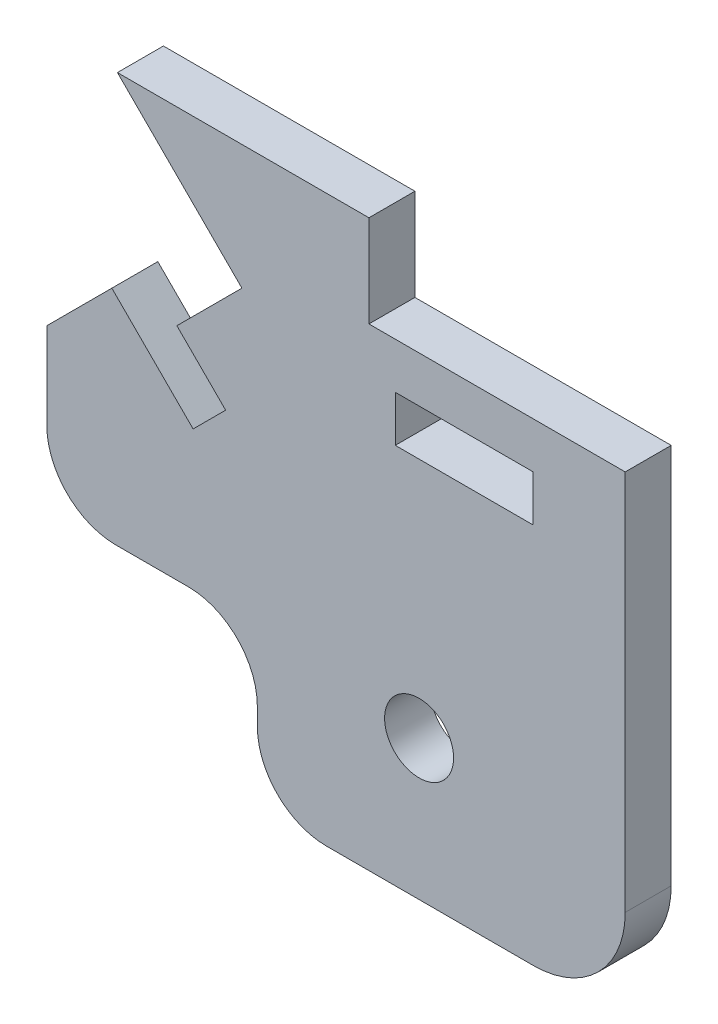
from build123d import *

# Parameters (mm, degrees)
MODEL_R             = 1.5
MODEL_W             = 6
MODEL_H             = 2
BOSS_EXTRUDE1_DEPTH = 2
BOSS_EXTRUDE2_DEPTH = 2


with BuildPart() as part:
    # Model → Boss-Extrude1 (new body)
    with BuildSketch(Plane.XY):
        with BuildLine():
            Line((6.363961031, 1.171572875), (2.828427125, 4.707106781))
            Line((2.828427125, 4.707106781), (0, 1.878679656))
            Line((0, 1.878679656), (0, -1.878679656))
            ThreePointArc((0, -1.878679656), (0.878679656, -4), (3, -4.878679656))
            Line((3, -4.878679656), (5.828427125, -4.878679656))
            Line((5.828427125, -4.878679656), (6.156854249, -4.878679656))
            ThreePointArc((6.156854249, -4.878679656), (8.278174593, -5.757359313), (9.156854249, -7.878679656))
            Line((9.156854249, -7.878679656), (9.156854249, -8.641362585))
            ThreePointArc((9.156854249, -8.641362585), (10.035533906, -10.762682929), (12.156854249, -11.641362585))
            Line((12.156854249, -11.641362585), (21.156854249, -11.641362585))
            ThreePointArc((21.156854249, -11.641362585), (23.985281374, -10.46978971), (25.156854249, -7.641362585))
            Line((25.156854249, -7.641362585), (25.156854249, 8.949747468))
            Line((25.156854249, 8.949747468), (14.01040764, 8.949747468))
            Line((14.01040764, 8.949747468), (14.01040764, 12.949747468))
            Line((14.01040764, 12.949747468), (7.071067812, 12.949747468))
            Line((7.071067812, 12.949747468), (7.071067812, 8.949747468))
            Line((7.071067812, 8.949747468), (8.485281374, 7.535533906))
            Line((8.485281374, 7.535533906), (5.656854249, 4.707106781))
            Line((5.656854249, 4.707106781), (7.778174593, 2.585786438))
            Line((7.778174593, 2.585786438), (6.363961031, 1.171572875))
        make_face()
        with Locations((16.191687414, -5.558946351)):
            Circle(MODEL_R, mode=Mode.SUBTRACT)
        with Locations((18.156854249, 5.949747468)):
            Rectangle(MODEL_W, MODEL_H, mode=Mode.SUBTRACT)
    extrude(amount=BOSS_EXTRUDE1_DEPTH)

    # Sketch10 → Boss-Extrude2 (add)
    with BuildSketch(Plane.XY.offset(2)):
        Polygon((7.071067812, 12.949747468), (3.071067812, 12.949747468), (7.071067812, 8.949747468), align=None)
    extrude(amount=-BOSS_EXTRUDE2_DEPTH)


solid = part.part
